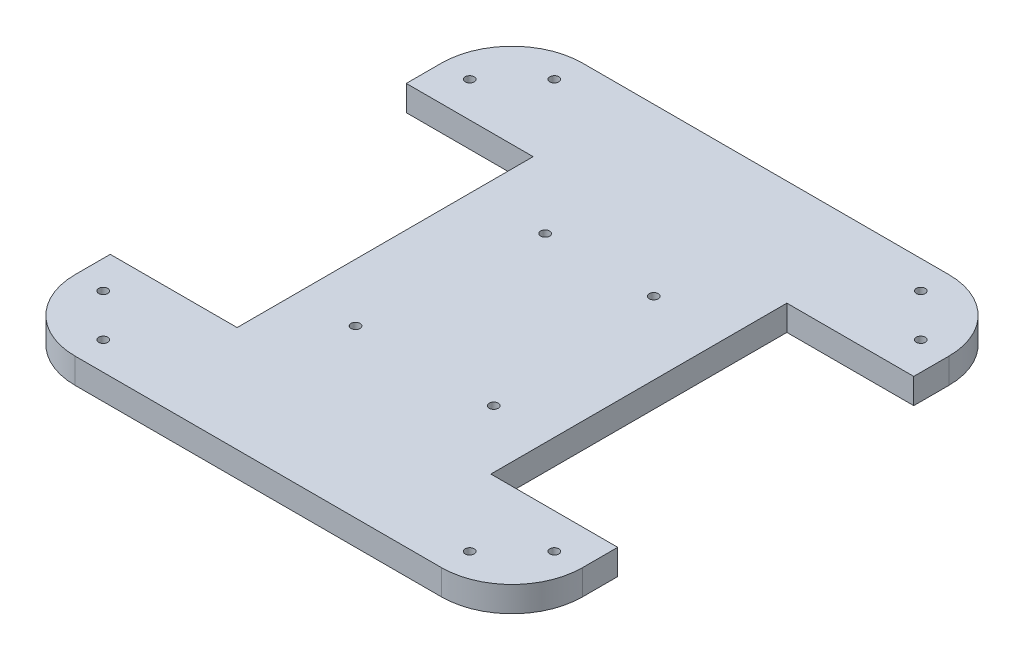
from build123d import *

# Parameters (mm, degrees)
PLATE_DEPTH         = 9
SKETCH3_R           = 1.6
HEX_HOLES_DEPTH     = 128.597021909
SKETCH4_R           = 1.6
ARDUINO_HOLES_DEPTH = 128.597021909
SKETCH5_W           = 45
SKETCH5_H           = 105
CUT_EXTRUDE1_DEPTH  = 128.597021909


with BuildPart() as part:
    # Sketch1 → Plate (new body)
    with BuildSketch(Plane(origin=(0, 0, 0), x_dir=(1, 0, 0), z_dir=(0, 1, 0))):
        with BuildLine():
            Line((-65, -90), (65, -90))
            ThreePointArc((65, -90), (82.67766953, -82.67766953), (90, -65))
            Line((90, -65), (90, 65))
            ThreePointArc((90, 65), (82.67766953, 82.67766953), (65, 90))
            Line((65, 90), (-65, 90))
            ThreePointArc((-65, 90), (-82.67766953, 82.67766953), (-90, 65))
            Line((-90, 65), (-90, -65))
            ThreePointArc((-90, -65), (-82.67766953, -82.67766953), (-65, -90))
        make_face()
    extrude(amount=PLATE_DEPTH)

    # Sketch3 → Hex Holes (cut, through all)
    with BuildSketch(Plane(origin=(0, 9, 0), x_dir=(1, 0, 0), z_dir=(0, 1, 0))):
        with Locations((-65, 80)):
            Circle(SKETCH3_R)
        with Locations((-80, 65)):
            Circle(SKETCH3_R)
        with Locations((80, 65)):
            Circle(SKETCH3_R)
        with Locations((80, -65)):
            Circle(SKETCH3_R)
        with Locations((65, 80)):
            Circle(SKETCH3_R)
        with Locations((65, -80)):
            Circle(SKETCH3_R)
        with Locations((-65, -80)):
            Circle(SKETCH3_R)
        with Locations((-80, -65)):
            Circle(SKETCH3_R)
    extrude(amount=-HEX_HOLES_DEPTH, mode=Mode.SUBTRACT)

    # Sketch4 → Arduino Holes (cut, through all)
    with BuildSketch(Plane(origin=(0, 9, 0), x_dir=(1, 0, 0), z_dir=(0, 1, 0))):
        with Locations((-24.5, -31)):
            Circle(SKETCH4_R)
        with Locations((24.5, -31)):
            Circle(SKETCH4_R)
        with Locations((-19.25, 31)):
            Circle(SKETCH4_R)
        with Locations((19.25, 31)):
            Circle(SKETCH4_R)
    extrude(amount=-ARDUINO_HOLES_DEPTH, mode=Mode.SUBTRACT)

    # Sketch5 → Cut-Extrude1 (cut, through all)
    with BuildSketch(Plane(origin=(0, 9, 0), x_dir=(1, 0, 0), z_dir=(0, 1, 0))):
        with Locations((-67.5, 0)):
            Rectangle(SKETCH5_W, SKETCH5_H)
        with Locations((67.5, 0)):
            Rectangle(SKETCH5_W, SKETCH5_H)
    extrude(amount=-CUT_EXTRUDE1_DEPTH, mode=Mode.SUBTRACT)


solid = part.part
